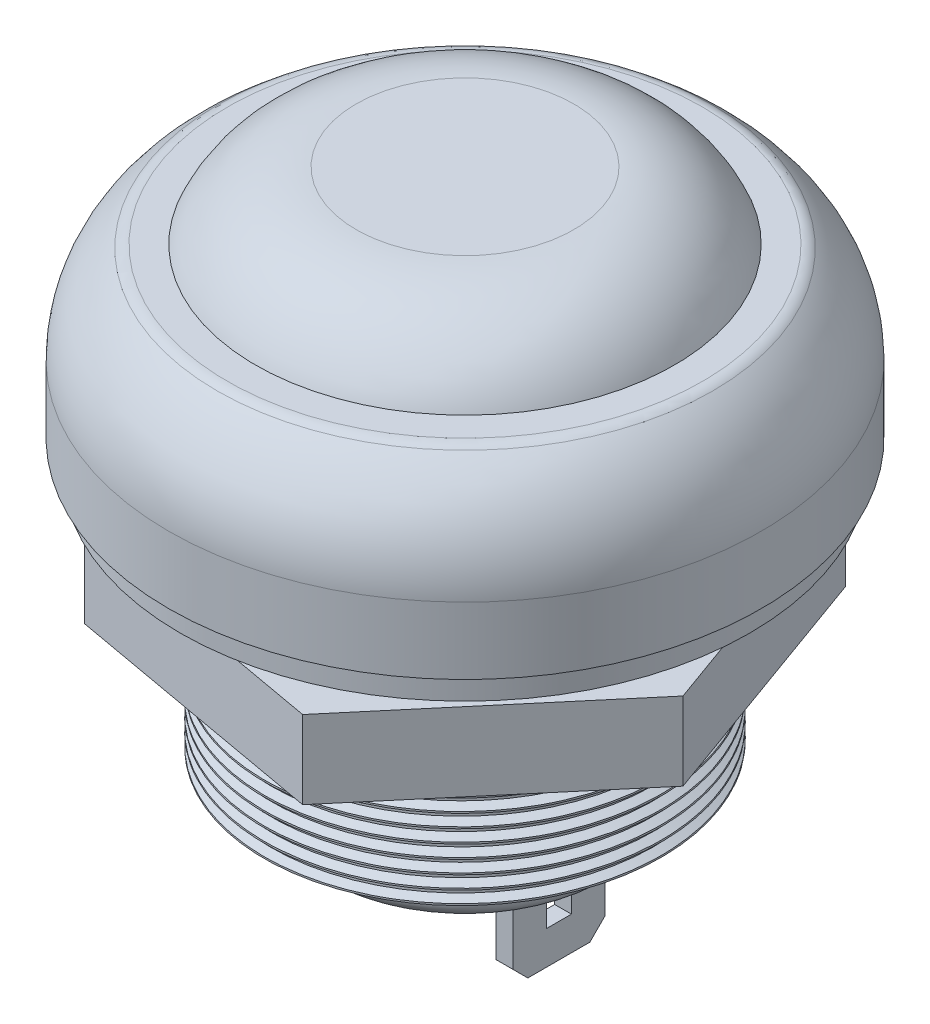
from build123d import *

# Parameters (mm, degrees)
SKETCH2_R                = 4.295
BOSS_EXTRUDE1_DEPTH      = 1.5
SKETCH3_W                = 0.5
SKETCH3_H                = 2.75
BOSS_EXTRUDE2_DEPTH      = 2.6
BOSS_EXTRUDE2_2_DEPTH    = 2.6
SKETCH5_R                = 6.25
BOSS_EXTRUDE3_DEPTH      = 2
THREAD1_PITCH            = 0.396875
CUT_EXTRUDE1_START       = -0.5
CUT_EXTRUDE1_OUTLINE_W   = 0.75
CUT_EXTRUDE1_OUTLINE_H   = 1.6
CUT_EXTRUDE1_DEPTH       = 0.5
CUT_EXTRUDE1_START_2     = -5.6
CUT_EXTRUDE1_2_OUTLINE_W = 0.75
CUT_EXTRUDE1_2_OUTLINE_H = 1.6
CUT_EXTRUDE1_2_DEPTH     = 0.5
CHAMFER1_SIZE            = 0.45
CHAMFER2_SIZE            = 0.45
FILLET1_R                = 0.5
FILLET2_R                = 0.5
SKETCH15_R               = 8.5
SKETCH15_R_2             = 6.8
BOSS_EXTRUDE4_DEPTH      = 0.8
SKETCH16_R               = 5.5
BOSS_EXTRUDE5_DEPTH      = 2.33
SCALE1_SCALE             = 2


with BuildPart() as part:
    # Sketch1 → Revolve1 (revolve)
    with BuildSketch(Plane.XY, mode=Mode.PRIVATE) as revolve1_sk:
        Polygon((0, 6.5), (0, -6.5), (5.915, -6.5), (5.915, -0.3), (6.74, -0.3), (6.74, 1.5), (8.84, 1.5), (8.84, 6.5), align=None)
    revolve(revolve1_sk.sketch.rotate(Axis((0, 6.5, 0), (0, -1, 0)), 90), axis=Axis((0, 6.5, 0), (0, -1, 0)))

    # Sketch9 → Cut-Revolve2 (revolve, cut)
    with BuildSketch(Plane.XY, mode=Mode.PRIVATE) as cut_revolve2_sk:
        with BuildLine():
            Line((8.84, 3.5), (9.598817433, 3.5))
            Line((9.598817433, 3.5), (9.598817433, 6.865118826))
            Line((9.598817433, 6.865118826), (7.25, 6.865118826))
            Line((7.25, 6.865118826), (7.25, 6.5))
            ThreePointArc((7.25, 6.5), (8.417929795, 5.197652791), (8.84, 3.5))
        make_face()
    revolve(cut_revolve2_sk.sketch.rotate(Axis((0, 8.5, 0), (0, -1, 0)), 90), axis=Axis((0, 8.5, 0), (0, -1, 0)), mode=Mode.SUBTRACT)

    # Thread1: arcs per turn and ends read off the stored shape
    # Thread1: the profile of Thread Profile1 profile screwed along a right-hand helix through 17.5 turns, 6 arcs to a turn; built about Z, then put on its axis
    thread1_z = Axis((0, 0, 0), (0, 0, 1))
    thread1_corners = [(5.9153, 0, -0.000173205), (5.9153, 0, 0.347438829), (5.700185106, 0, 0.223242187), (5.700185106, 0, 0.124023437)]
    with BuildLine(mode=Mode.PRIVATE) as thread1_profile:
        Line(thread1_corners[0], thread1_corners[1])
        Line(thread1_corners[1], thread1_corners[2])
        Line(thread1_corners[2], thread1_corners[3])
        Line(thread1_corners[3], thread1_corners[0])
    thread1_cap = Face(thread1_profile.wire())
    thread1_turn_angles = [0, 30, 60, 90, 120, 150, 180, 210, 240, 270, 300, 330, 360]
    thread1_turn_weights = [1, 0.8660254037844387, 1, 0.8660254037844387, 1, 0.8660254037844387, 1, 0.8660254037844387, 1, 0.8660254037844387, 1, 0.8660254037844387, 1]
    thread1_turn_rails = [Edge.make_bspline([Vector(p[0], p[1], 0).rotate(thread1_z, thread1_turn_angles[k]) / thread1_turn_weights[k] + Vector(0, 0, p[2] + THREAD1_PITCH * thread1_turn_angles[k] / 360) for k in range(13)], [0, 0, 0, 1, 1, 2, 2, 3, 3, 4, 4, 5, 5, 6, 6, 6], 2, thread1_turn_weights) for p in thread1_corners]
    thread1_turn_sides = [Face.make_surface_from_curves(thread1_turn_rails[p[0]], thread1_turn_rails[p[1]]) for p in [(0, 1), (1, 2), (2, 3), (3, 0)]]
    thread1_last_angles = [6120, 6150, 6180, 6210, 6240, 6270, 6300]
    thread1_last_weights = [1, 0.8660254037844387, 1, 0.8660254037844387, 1, 0.8660254037844387, 1]
    thread1_last_rails = [Edge.make_bspline([Vector(p[0], p[1], 0).rotate(thread1_z, thread1_last_angles[k]) / thread1_last_weights[k] + Vector(0, 0, p[2] + THREAD1_PITCH * thread1_last_angles[k] / 360) for k in range(7)], [0, 0, 0, 1, 1, 2, 2, 3, 3, 3], 2, thread1_last_weights) for p in thread1_corners]
    thread1_last_sides = [Face.make_surface_from_curves(thread1_last_rails[p[0]], thread1_last_rails[p[1]]) for p in [(0, 1), (1, 2), (2, 3), (3, 0)]]
    thread1 = Plane(origin=(0, -7.5, 0), x_dir=(1, 0, 0), z_dir=(0, 1, 0)) * Solid(Shell([*[p.moved(Location((0, 0, THREAD1_PITCH * i))) for i in range(17) for p in thread1_turn_sides], *thread1_last_sides, thread1_cap, thread1_cap.rotate(thread1_z, 6300).moved(Location((0, 0, THREAD1_PITCH * 6300 / 360)))]))
    add(thread1, mode=Mode.SUBTRACT)

    # Fillet1
    fillet1_edges = [part.edges().sort_by_distance(p)[0] for p in [
        (0, 6.5, -7.25),
    ]]
    fillet(fillet1_edges, radius=FILLET1_R)


with BuildPart() as body_2:
    # Sketch2 → Boss-Extrude1 (new body)
    with BuildSketch(Plane.XZ.offset(6.5)):
        with Locations(Location((0, 0, 0), (0, 0, 270))):
            Circle(SKETCH2_R)
    extrude(amount=BOSS_EXTRUDE1_DEPTH)

    # Fillet2
    fillet2_edges = [body_2.edges().sort_by_distance(p)[0] for p in [
        (0, -8, 4.295),
    ]]
    fillet(fillet2_edges, radius=FILLET2_R)


with BuildPart() as body_3:
    # Sketch3 → Boss-Extrude2 (new body)
    with BuildSketch(Plane.XZ.offset(8)):
        with Locations((2.55, 0)):
            Rectangle(SKETCH3_W, SKETCH3_H)
    extrude(amount=BOSS_EXTRUDE2_DEPTH)

    # Cut-Extrude1 2 outline → Cut-Extrude1 2 (cut)
    with BuildSketch(Plane.ZY.offset(2.8).offset(CUT_EXTRUDE1_START_2)):
        with Locations((0, -8.8)):
            Rectangle(CUT_EXTRUDE1_2_OUTLINE_W, CUT_EXTRUDE1_2_OUTLINE_H)
    extrude(amount=CUT_EXTRUDE1_2_DEPTH, mode=Mode.SUBTRACT)

    # Chamfer2
    chamfer2_edges = [body_3.edges().sort_by_distance(p)[0] for p in [
        (2.55, -10.6, -1.375),
        (2.55, -10.6, 1.375),
    ]]
    chamfer(chamfer2_edges, length=CHAMFER2_SIZE)


with BuildPart() as body_4:
    # Sketch3 → Boss-Extrude2 2 (new body)
    with BuildSketch(Plane.XZ.offset(8)):
        with Locations((-2.55, 0)):
            Rectangle(SKETCH3_W, SKETCH3_H)
    extrude(amount=BOSS_EXTRUDE2_2_DEPTH)

    # Cut-Extrude1: read off the stored shape, not the designer's step
    # Cut-Extrude1 outline → Cut-Extrude1 (cut)
    with BuildSketch(Plane.ZY.offset(2.8).offset(CUT_EXTRUDE1_START)):
        with Locations((0, -8.8)):
            Rectangle(CUT_EXTRUDE1_OUTLINE_W, CUT_EXTRUDE1_OUTLINE_H)
    extrude(amount=CUT_EXTRUDE1_DEPTH, mode=Mode.SUBTRACT)

    # Chamfer1
    chamfer1_edges = [body_4.edges().sort_by_distance(p)[0] for p in [
        (-2.55, -10.6, -1.375),
        (-2.55, -10.6, 1.375),
    ]]
    chamfer(chamfer1_edges, length=CHAMFER1_SIZE)


with BuildPart() as body_5:
    # Sketch5 → Boss-Extrude3 (new body)
    with BuildSketch(Plane(origin=(0, 6.5, 0), x_dir=(1, 0, 0), z_dir=(0, 1, 0))):
        with Locations(Location((0, 0, 0), (0, 0, 270))):
            Circle(SKETCH5_R)
    extrude(amount=BOSS_EXTRUDE3_DEPTH)

    # Sketch8 → Cut-Revolve1 (revolve, cut)
    with BuildSketch(Plane.XY, mode=Mode.PRIVATE) as cut_revolve1_sk:
        with BuildLine():
            Line((3.25, 8.5), (3.25, 9.819478645))
            Line((3.25, 9.819478645), (7.095108276, 9.819478645))
            Line((7.095108276, 9.819478645), (7.095108276, 6.5))
            Line((7.095108276, 6.5), (6.25, 6.5))
            ThreePointArc((6.25, 6.5), (5.052775638, 7.954163457), (3.25, 8.5))
        make_face()
    revolve(cut_revolve1_sk.sketch.rotate(Axis((0, 8.5, 0), (0, -1, 0)), 180), axis=Axis((0, 8.5, 0), (0, -1, 0)), mode=Mode.SUBTRACT)


with BuildPart() as body_6:
    # Sketch15 → Boss-Extrude4 (new body)
    with BuildSketch(Plane.XZ.offset(-1.5)):
        with Locations(Location((0, 0, 0), (0, 0, 270))):
            Circle(SKETCH15_R)
        with Locations(Location((0, 0, 0), (0, 0, 270))):
            Circle(SKETCH15_R_2, mode=Mode.SUBTRACT)
    extrude(amount=BOSS_EXTRUDE4_DEPTH)


with BuildPart() as body_7:
    # Sketch16 → Boss-Extrude5 (new body)
    with BuildSketch(Plane.XZ.offset(0.5)):
        Polygon((5.195655548, -6.154076976), (7.927414772, 1.422531206), (2.731759224, 7.576608182), (-5.195655548, 6.154076976), (-7.927414772, -1.422531206), (-2.731759224, -7.576608182), align=None)
        with Locations(Location((0, 0, 0), (0, 0, 270))):
            Circle(SKETCH16_R, mode=Mode.SUBTRACT)
    extrude(amount=BOSS_EXTRUDE5_DEPTH)


with BuildPart() as part_1:
    # Scale1: scaled about (0, 0, 0)
    add(part.part.scale(SCALE1_SCALE))


with BuildPart() as body_2_1:
    # Scale1: scaled about (0, 0, 0)
    add(body_2.part.scale(SCALE1_SCALE))


with BuildPart() as body_3_1:
    # Scale1: scaled about (0, 0, 0)
    add(body_3.part.scale(SCALE1_SCALE))


with BuildPart() as body_4_1:
    # Scale1: scaled about (0, 0, 0)
    add(body_4.part.scale(SCALE1_SCALE))


with BuildPart() as body_5_1:
    # Scale1: scaled about (0, 0, 0)
    add(body_5.part.scale(SCALE1_SCALE))


with BuildPart() as body_7_1:
    # Scale1: scaled about (0, 0, 0)
    add(body_7.part.scale(SCALE1_SCALE))


with BuildPart() as body_6_1:
    # Scale1: scaled about (0, 0, 0)
    add(body_6.part.scale(SCALE1_SCALE))


solid = Compound([part_1.part, body_2_1.part, body_3_1.part, body_4_1.part, body_5_1.part, body_7_1.part, body_6_1.part])
